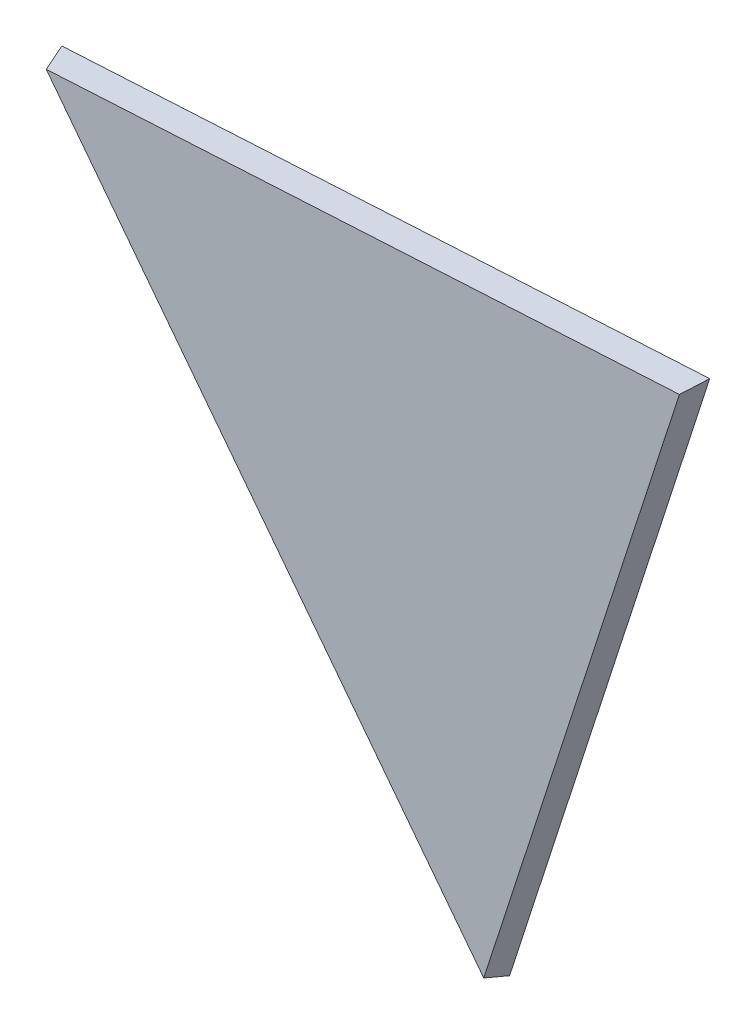
from build123d import *

# Parameters (mm, degrees)
EXTRUDE_1_DEPTH = 60
CHAMFER3_SIZE2  = 11.912970931
CHAMFER3_SIZE   = 60
CHAMFER4_SIZE2  = 11.912970931
CHAMFER4_SIZE   = 60
CHAMFER5_SIZE2  = 9.519169095
CHAMFER5_SIZE   = 60


with BuildPart() as part:
    # Эскиз1 → Бобышка-Вытянуть1 (new body)
    with BuildSketch(Plane.XY):
        Polygon((-849.589927609, 515.838957491), (787.506047005, 606.405063543), (281.615569427, -953.197537878), align=None)
    extrude(amount=EXTRUDE_1_DEPTH)

    # Chamfer3
    chamfer3_edges = [part.edges().sort_by_distance(p)[0] for p in [
        (-31.041940302, 561.122010517, 60),
    ]]
    chamfer3_side = [part.faces().sort_by_distance(p)[0] for p in [
        (-31.041940302, 561.122010517, 59.761740581),
    ]]
    chamfer(chamfer3_edges, length=CHAMFER3_SIZE - 0.0001, length2=CHAMFER3_SIZE2 - 0.0001, reference=chamfer3_side[0])  # a hair under: the kernel refuses the full size

    # Chamfer4
    chamfer4_edges = [part.edges().sort_by_distance(p)[0] for p in [
        (532.590398399, -179.470785737, 60),
    ]]
    chamfer4_side = [part.faces().sort_by_distance(p)[0] for p in [
        (532.590398399, -179.470785737, 59.761740581),
    ]]
    chamfer(chamfer4_edges, length=CHAMFER4_SIZE - 0.0001, length2=CHAMFER4_SIZE2 - 0.0001, reference=chamfer4_side[0])  # a hair under: the kernel refuses the full size

    # Chamfer5
    chamfer5_edges = [part.edges().sort_by_distance(p)[0] for p in [
        (-283.987179091, -218.679290193, 60),
    ]]
    chamfer5_side = [part.faces().sort_by_distance(p)[0] for p in [
        (-283.987179091, -218.679290193, 59.809616618),
    ]]
    chamfer(chamfer5_edges, length=CHAMFER5_SIZE - 0.0001, length2=CHAMFER5_SIZE2 - 0.0001, reference=chamfer5_side[0])  # a hair under: the kernel refuses the full size


solid = part.part
